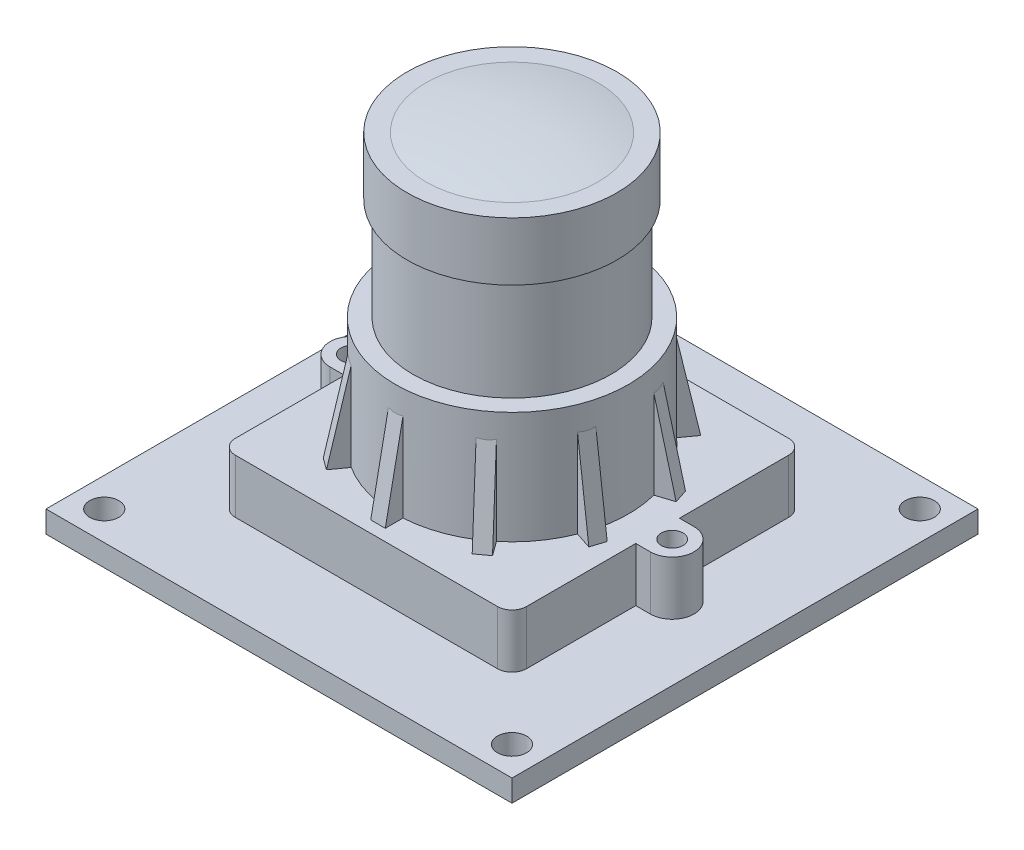
from build123d import *

# Parameters (mm, degrees)
SKETCH_1_W          = 32
SKETCH_1_H          = 32
SKETCH_1_R          = 1
EXTRUDE_1_DEPTH     = 1.5
SKETCH_2_R          = 0.75
EXTRUDE_2_DEPTH     = 3.7
SKETCH1_R           = 8
BOSS_EXTRUDE1_DEPTH = 7.7
RIB1_REACH          = 28.046
SKETCH4_WALL_W      = 60.211433256
SKETCH4_WALL_H      = 1
CIRPATTERN1_COUNT   = 10
FILLET1_R           = 1


with BuildPart() as part:
    # 草图1 → 凸台-拉伸1 (new body)
    with BuildSketch(Plane(origin=(0, 0, 0), x_dir=(1, 0, 0), z_dir=(0, 1, 0))):
        Rectangle(SKETCH_1_W, SKETCH_1_H)
        with Locations((-14, 14)):
            Circle(SKETCH_1_R, mode=Mode.SUBTRACT)
        with Locations((14, 14)):
            Circle(SKETCH_1_R, mode=Mode.SUBTRACT)
        with Locations((14, -14)):
            Circle(SKETCH_1_R, mode=Mode.SUBTRACT)
        with Locations((-14, -14)):
            Circle(SKETCH_1_R, mode=Mode.SUBTRACT)
    extrude(amount=EXTRUDE_1_DEPTH)

    # 草图2 → 凸台-拉伸2 (add)
    with BuildSketch(Plane(origin=(0, 1.5, 0), x_dir=(1, 0, 0), z_dir=(0, 1, 0))):
        with BuildLine():
            Line((-10, -10), (10, -10))
            Line((10, -10), (10, -1.5))
            Line((10, -1.5), (11, -1.5))
            ThreePointArc((11, -1.5), (12.5, 0), (11, 1.5))
            Line((11, 1.5), (10, 1.5))
            Line((10, 1.5), (10, 10))
            Line((10, 10), (-10, 10))
            Line((-10, 10), (-10, 1.5))
            Line((-10, 1.5), (-11, 1.5))
            ThreePointArc((-11, 1.5), (-12.5, 0), (-11, -1.5))
            Line((-11, -1.5), (-10, -1.5))
            Line((-10, -1.5), (-10, -10))
        make_face()
        with Locations((11, 0)):
            Circle(SKETCH_2_R, mode=Mode.SUBTRACT)
        with Locations((-11, 0)):
            Circle(SKETCH_2_R, mode=Mode.SUBTRACT)
    extrude(amount=EXTRUDE_2_DEPTH)

    # Sketch1 → Boss-Extrude1 (add)
    with BuildSketch(Plane(origin=(0, 5.2, 0), x_dir=(1, 0, 0), z_dir=(0, 1, 0))):
        Circle(SKETCH1_R)
    extrude(amount=BOSS_EXTRUDE1_DEPTH)

    # Sketch4 wall → Rib1 (add, up to next)
    with BuildSketch(Plane(origin=(0, 8.2, -8.6), x_dir=(0, -0.980580675691, -0.196116135138), z_dir=(0, 0.196116135138, -0.980580675691)), mode=Mode.PRIVATE) as rib1_sk1:
        Rectangle(SKETCH4_WALL_W, SKETCH4_WALL_H)
    rib1_tool1 = extrude(rib1_sk1.sketch, amount=-RIB1_REACH, mode=Mode.PRIVATE) - part.part
    rib1 = rib1_tool1.solids().sort_by_distance((0, 8.2, -8.6))[0]
    add(rib1)

    # CirPattern1: Rib1 ×10 about axis
    cirpattern1_axis = Axis((0, 12.9, 0), (0, 1, 0))
    for i in range(1, CIRPATTERN1_COUNT):
        add(rib1.rotate(cirpattern1_axis, i * 360 / CIRPATTERN1_COUNT))

    # Sketch5 → Revolve1 (revolve)
    with BuildSketch(Plane(origin=(0, 0, 0), x_dir=(0, 0, -1), z_dir=(1, 0, 0))):
        Polygon((0, 23.9), (7.2, 23.9), (7.2, 19.9), (6.8, 19.9), (6.8, 12.9), (0, 12.9), align=None)
    revolve(axis=Axis((0, 12.9, 0), (0, 1, 0)))

    # Fillet1
    fillet1_edges = [part.edges().sort_by_distance(p)[0] for p in [
        (-10, 3.35, 10),
        (10, 3.35, 10),
        (-10, 3.35, -10),
        (10, 3.35, -10),
    ]]
    fillet(fillet1_edges, radius=FILLET1_R)

    # Sketch6 → Revolve3 (revolve)
    with BuildSketch(Plane.XY):
        with BuildLine():
            Line((-5.907036739, 23.9), (0, 23.9))
            Line((0, 23.9), (0, 24.469867838))
            ThreePointArc((0, 24.469867838), (-2.967230712, 24.327070928), (-5.907036739, 23.9))
        make_face()
    revolve(axis=Axis((0, 24.469867838, 0), (0, -1, 0)))


solid = part.part
